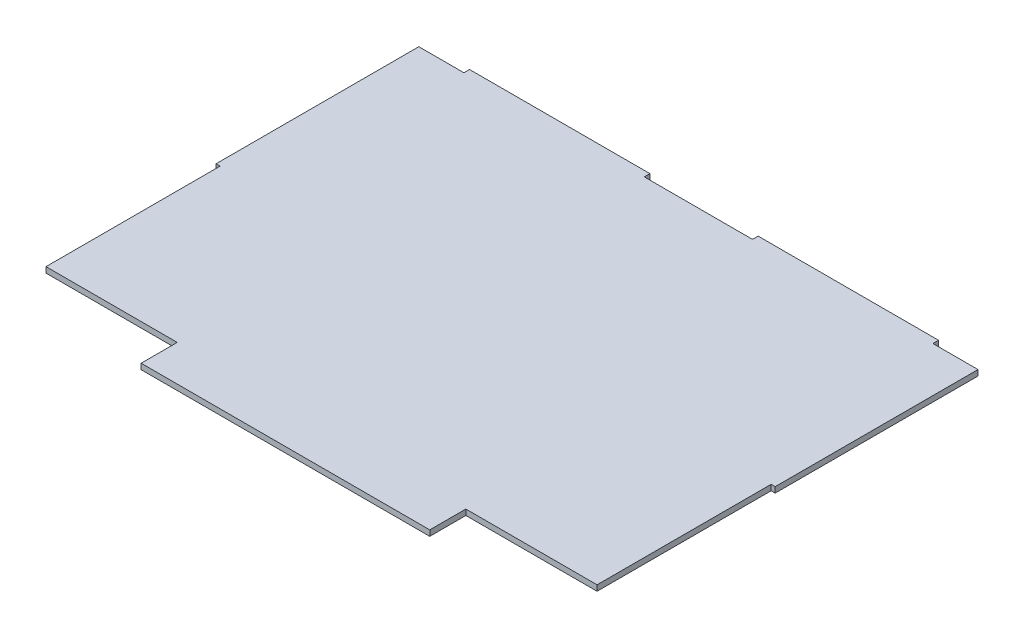
from build123d import *

# Parameters (mm, degrees)
SKETCH1_W           = 314.96461264
SKETCH1_H           = 3.175
BOSS_EXTRUDE1_DEPTH = 235.775
SKETCH3_W           = 25.4
SKETCH3_H           = 3.175
SKETCH3_W_2         = 60.96461264
CUT_EXTRUDE1_DEPTH  = 3.175
CUT_EXTRUDE2_START  = -3.175
SKETCH5_W           = 2.286
SKETCH5_H           = 118.364
CUT_EXTRUDE2_DEPTH  = 287.725009793
SKETCH6_W           = 73.914
SKETCH6_H           = 20.32
CUT_EXTRUDE4_DEPTH  = 284.550009793
SKETCH8_W           = 76.2
SKETCH8_H           = 20.32
CUT_EXTRUDE6_DEPTH  = 284.550009793


with BuildPart() as part:
    # Sketch1 → Boss-Extrude1 (new body)
    with BuildSketch(Plane.XY):
        Rectangle(SKETCH1_W, SKETCH1_H)
    extrude(amount=BOSS_EXTRUDE1_DEPTH)

    # Sketch3 → Cut-Extrude1 (cut)
    with BuildSketch(Plane(origin=(0, 0, 0), x_dir=(-1, 0, 0), z_dir=(0, 0, -1))):
        with Locations((-144.78230632, 0)):
            Rectangle(SKETCH3_W, SKETCH3_H)
        Rectangle(SKETCH3_W_2, SKETCH3_H)
        with Locations((144.78230632, 0)):
            Rectangle(SKETCH3_W, SKETCH3_H)
    extrude(amount=-CUT_EXTRUDE1_DEPTH, mode=Mode.SUBTRACT)

    # Sketch5 → Cut-Extrude2 (cut)
    with BuildSketch(Plane(origin=(0, 1.5875, 0), x_dir=(1, 0, 0), z_dir=(0, 1, 0)).offset(CUT_EXTRUDE2_START)):
        with Locations((-156.33930632, -176.593)):
            Rectangle(SKETCH5_W, SKETCH5_H)
    cut_extrude2 = extrude(amount=CUT_EXTRUDE2_DEPTH, mode=Mode.SUBTRACT)

    # Mirror1: Cut-Extrude2 across plane
    add(cut_extrude2.mirror(Plane(origin=(0, 0, 0), x_dir=(0, 0, 1), z_dir=(1, 0, 0))), mode=Mode.SUBTRACT)

    # Sketch6 → Cut-Extrude4 (cut, through all)
    with BuildSketch(Plane(origin=(0, 1.5875, 0), x_dir=(1, 0, 0), z_dir=(0, 1, 0))):
        with Locations((-118.23930632, -225.615)):
            Rectangle(SKETCH6_W, SKETCH6_H)
    extrude(amount=-CUT_EXTRUDE4_DEPTH, mode=Mode.SUBTRACT)

    # Sketch8 → Cut-Extrude6 (cut, through all)
    with BuildSketch(Plane(origin=(0, 1.5875, 0), x_dir=(1, 0, 0), z_dir=(0, 1, 0))):
        with Locations((119.38230632, -225.615)):
            Rectangle(SKETCH8_W, SKETCH8_H)
    extrude(amount=-CUT_EXTRUDE6_DEPTH, mode=Mode.SUBTRACT)


solid = part.part
